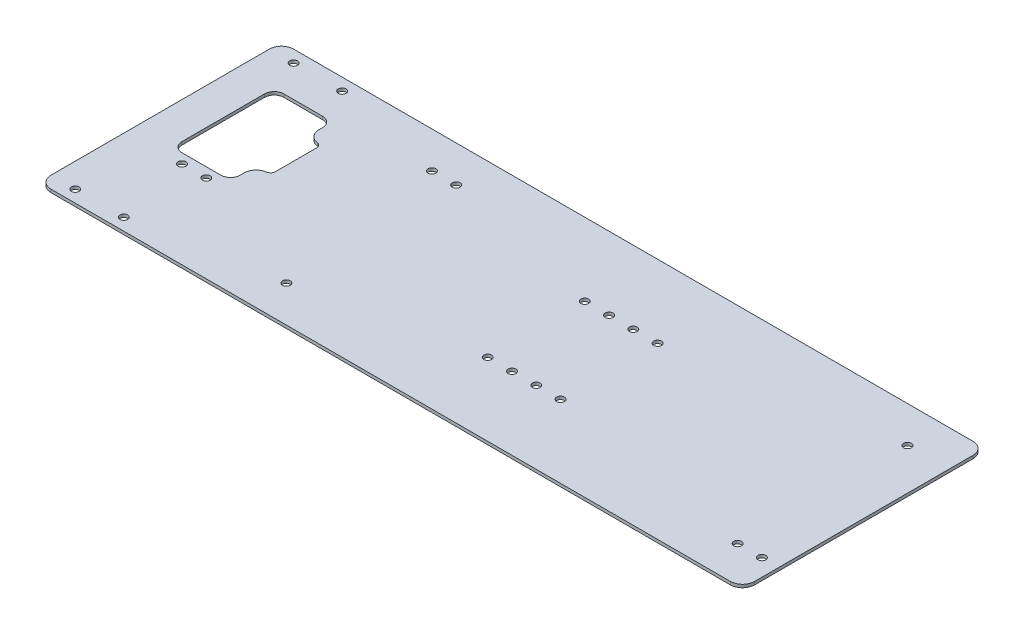
from build123d import *

# Parameters (mm, degrees)
SKETCH1_W           = 368.3
SKETCH1_H           = 127
SKETCH1_R           = 2.032
BOSS_EXTRUDE1_DEPTH = 1.5875
FILLET1_R           = 5.08
FILLET3_R           = 6.35
FILLET4_R           = 2.54
FILLET5_R           = 6.35
SKETCH3_R           = 2.032
CUT_EXTRUDE5_DEPTH  = 195.797311855


with BuildPart() as part:
    # Sketch1 → Boss-Extrude1 (new body)
    with BuildSketch(Plane(origin=(0, 0, 0), x_dir=(1, 0, 0), z_dir=(0, 1, 0))):
        Rectangle(SKETCH1_W, SKETCH1_H)
        with Locations((-171.45, -57.15)):
            Circle(SKETCH1_R, mode=Mode.SUBTRACT)
        with Locations((-146.05, -57.15)):
            Circle(SKETCH1_R, mode=Mode.SUBTRACT)
        with Locations((-154.94, -17.78)):
            Circle(SKETCH1_R, mode=Mode.SUBTRACT)
        with Locations((-142.24, -17.78)):
            Circle(SKETCH1_R, mode=Mode.SUBTRACT)
        Polygon((-134.62, -12.7), (-165.1, -12.7), (-165.1, 40.64), (-134.62, 40.64), (-134.62, 27.305), (-127, 27.305), (-127, 0.635), (-134.62, 0.635), align=None, mode=Mode.SUBTRACT)
        with Locations((-171.45, 57.15)):
            Circle(SKETCH1_R, mode=Mode.SUBTRACT)
        with Locations((-146.05, 57.15)):
            Circle(SKETCH1_R, mode=Mode.SUBTRACT)
    extrude(amount=BOSS_EXTRUDE1_DEPTH)

    # Fillet1
    fillet1_edges = [part.edges().sort_by_distance(p)[0] for p in [
        (-134.62, 0.79375, 12.7),
        (-165.1, 0.79375, 12.7),
        (-165.1, 0.79375, -40.64),
        (-134.62, 0.79375, -40.64),
    ]]
    fillet(fillet1_edges, radius=FILLET1_R)

    # Fillet3
    fillet3_edges = [part.edges().sort_by_distance(p)[0] for p in [
        (184.15, 0.79375, 63.5),
        (184.15, 0.79375, -63.5),
        (-184.15, 0.79375, 63.5),
        (-184.15, 0.79375, -63.5),
    ]]
    fillet(fillet3_edges, radius=FILLET3_R)

    # Fillet4
    fillet4_edges = [part.edges().sort_by_distance(p)[0] for p in [
        (-127, 0.79375, -0.635),
        (-127, 0.79375, -27.305),
    ]]
    fillet(fillet4_edges, radius=FILLET4_R)

    # Fillet5
    fillet5_edges = [part.edges().sort_by_distance(p)[0] for p in [
        (-134.62, 0.79375, -0.635),
        (-134.62, 0.79375, -27.305),
    ]]
    fillet(fillet5_edges, radius=FILLET5_R)

    # Sketch3 → Cut-Extrude5 (cut, through all)
    with BuildSketch(Plane(origin=(0, 1.5875, 0), x_dir=(1, 0, 0), z_dir=(0, 1, 0))):
        with Locations((12.7, -25.4)):
            Circle(SKETCH3_R)
        with Locations((25.4, -25.4)):
            Circle(SKETCH3_R)
        with Locations((38.1, -25.4)):
            Circle(SKETCH3_R)
        with Locations((50.8, -25.4)):
            Circle(SKETCH3_R)
        with Locations((50.8, 25.4)):
            Circle(SKETCH3_R)
        with Locations((38.1, 25.4)):
            Circle(SKETCH3_R)
        with Locations((25.4, 25.4)):
            Circle(SKETCH3_R)
        with Locations((12.7, 25.4)):
            Circle(SKETCH3_R)
        with Locations((175.26, -44.45)):
            Circle(SKETCH3_R)
        with Locations((162.56, -44.45)):
            Circle(SKETCH3_R)
        with Locations((162.56, 44.45)):
            Circle(SKETCH3_R)
        with Locations((-73.66, 44.45)):
            Circle(SKETCH3_R)
        with Locations((-86.36, 44.45)):
            Circle(SKETCH3_R)
        with Locations((-73.66, -44.45)):
            Circle(SKETCH3_R)
    extrude(amount=-CUT_EXTRUDE5_DEPTH, mode=Mode.SUBTRACT)


solid = part.part
